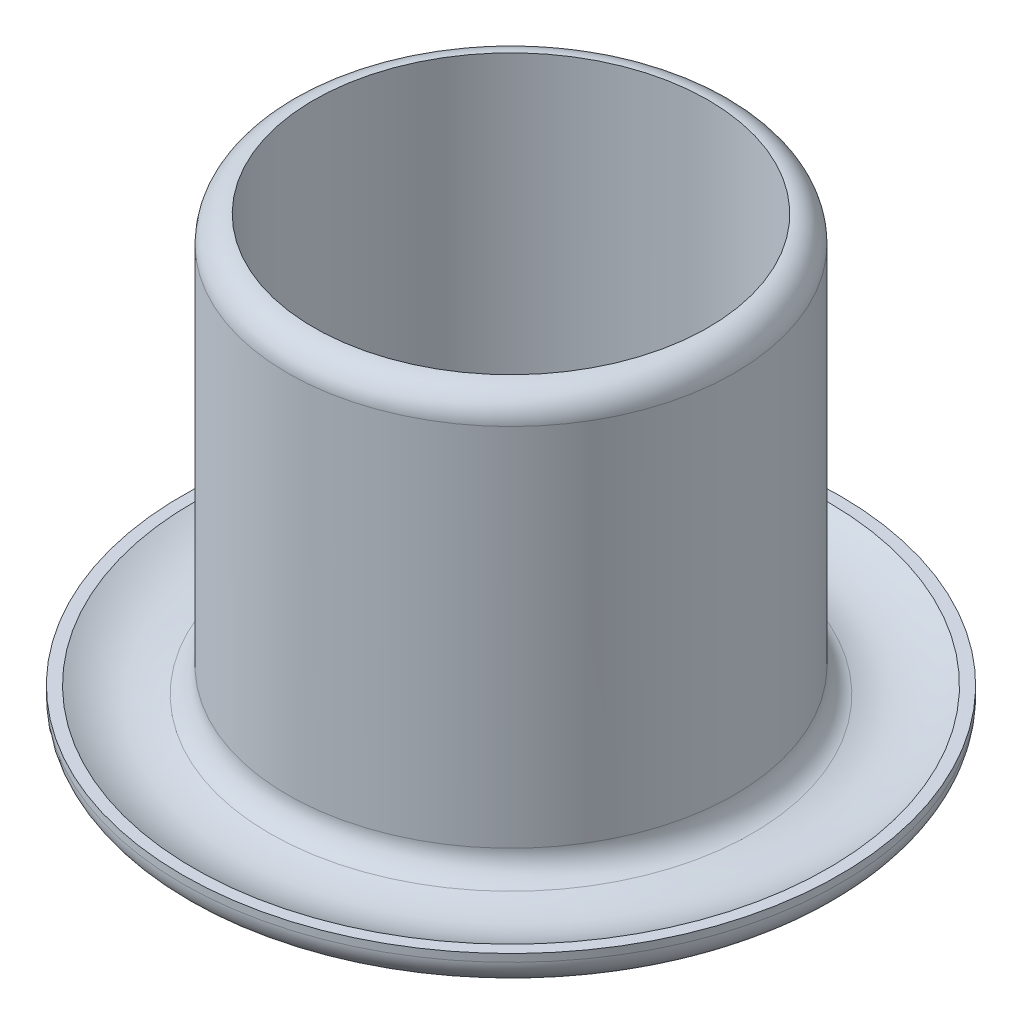
from build123d import *

# Parameters (mm, degrees)
FILLET1_R = 0.2


with BuildPart() as part:
    # Sketch2 → Revolve1 (revolve)
    with BuildSketch(Plane.XY, mode=Mode.PRIVATE) as revolve1_sk:
        with BuildLine():
            Line((2.5, 0), (2.5, 0.2))
            Line((2.5, 0.2), (2.413045567, 0.2))
            add(Edge.make_bspline(
                [(1.7, 0.2), (2.05568195, -4.4901e-05), (2.413045567, 0.2)],
                knots=[0, 0, 0, 1, 1, 1], degree=2))
            Line((1.7, 0.2), (1.7, 3.306439765))
            Line((1.7, 3.306439765), (1.5, 3.306439765))
            Line((1.5, 3.306439765), (1.5, 0))
            add(Edge.make_bspline(
                [(1.5, 0), (2.00398015, -0.201922677), (2.5, 0)],
                knots=[0, 0, 0, 1, 1, 1], degree=2))
        make_face()
    revolve(revolve1_sk.sketch.rotate(Axis((0, 0, 0), (0, 1, 0)), 90), axis=Axis((0, 0, 0), (0, 1, 0)))

    # Fillet1
    fillet1_edges = [part.edges().sort_by_distance(p)[0] for p in [
        (0, 0, 2.5),
        (0, 0.2, 1.7),
        (0, 3.306439765, 1.7),
        (0, 0, 1.5),
    ]]
    fillet(fillet1_edges, radius=FILLET1_R - 0.0001)  # a hair under: the kernel refuses the full size


solid = part.part
